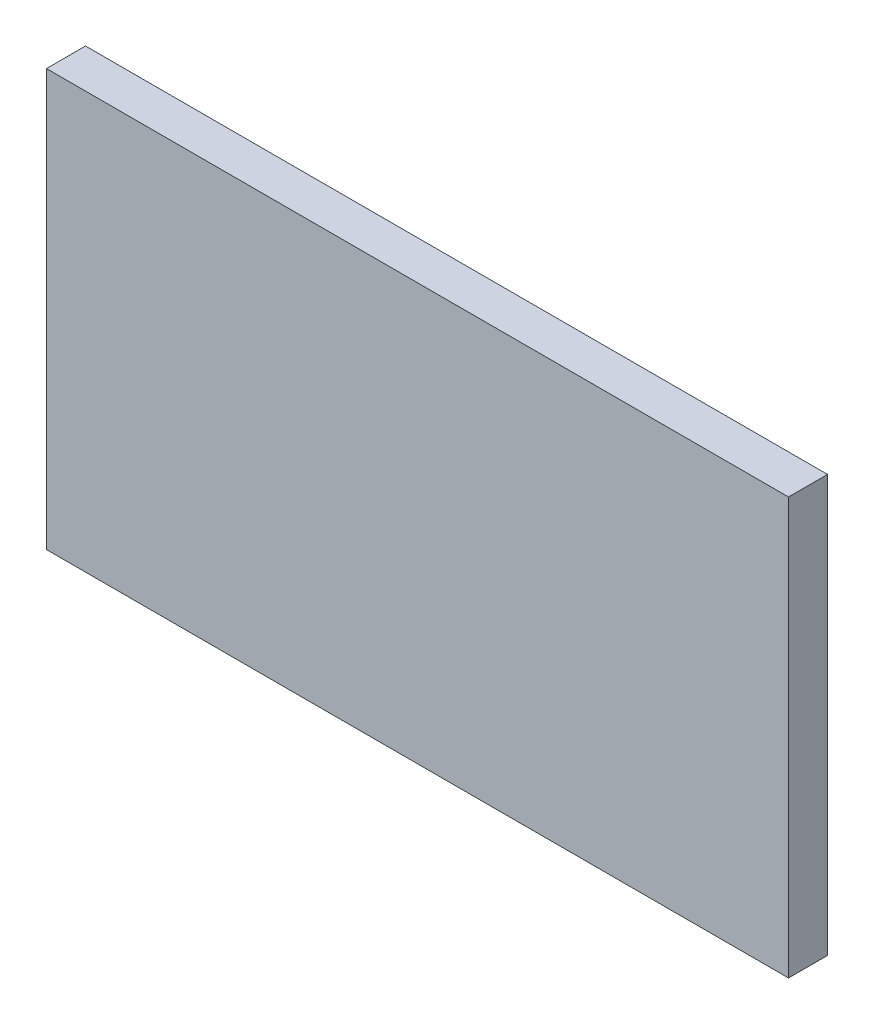
from build123d import *

# Parameters (mm, degrees)
SKETCH1_W           = 57
SKETCH1_H           = 32
BOSS_EXTRUDE1_DEPTH = 3


with BuildPart() as part:
    # Sketch1 → Boss-Extrude1 (new body)
    with BuildSketch(Plane.XY):
        with Locations((-7.514344262, 8.590163934)):
            Rectangle(SKETCH1_W, SKETCH1_H)
    extrude(amount=BOSS_EXTRUDE1_DEPTH)


solid = part.part
